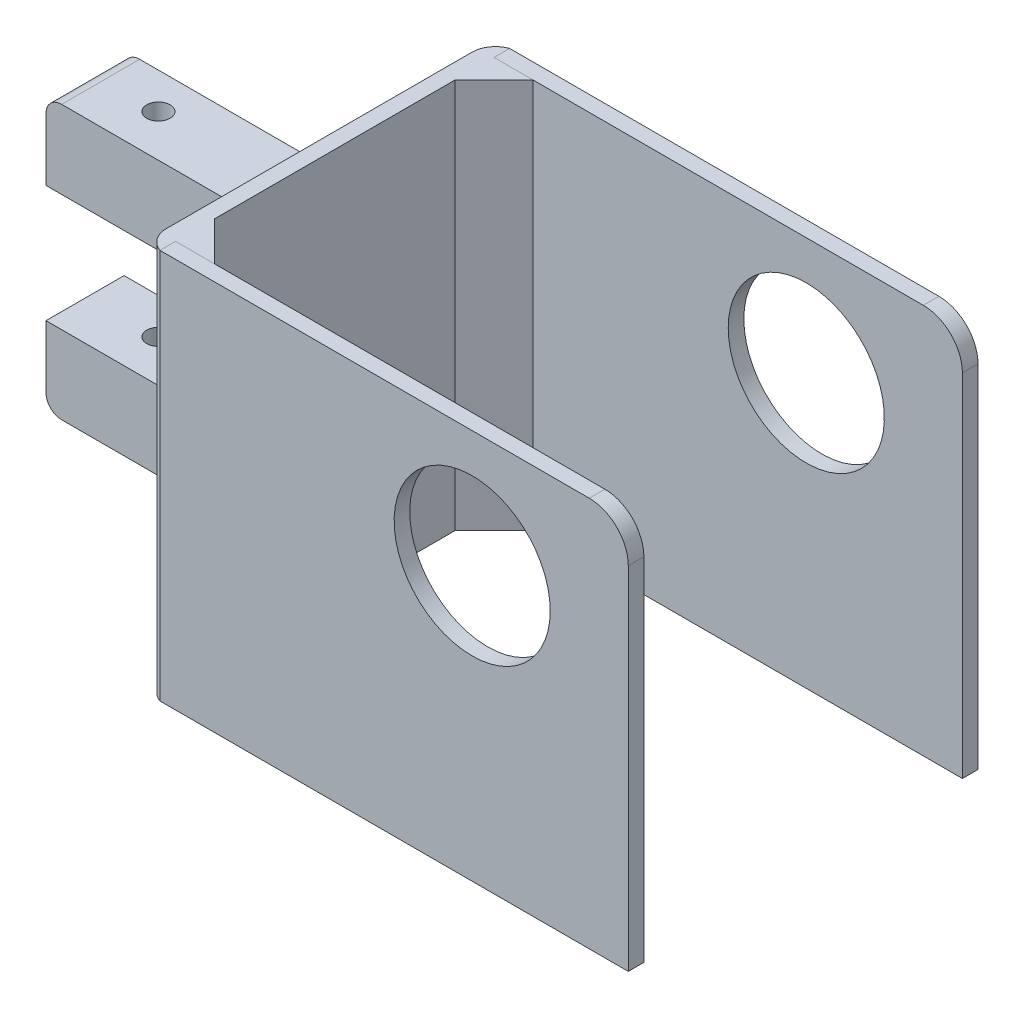
from build123d import *

# Parameters (mm, degrees)
SKETCH_3_R               = 3
EXTRUDE_6_DEPTH          = 0.001
EXTRUDE_6_2_DEPTH        = 0.001
EXTRUDE_6_3_DEPTH        = 0.001
EXTRUDE_6_4_DEPTH        = 0.001
CUT_EXTRUDE_2_DEPTH      = 67.213034483
CUT_EXTRUDE_2_DEPTH_BACK = 67.213034483
SKETCH_11_R              = 2.25
EXTRUDE_7_DEPTH          = 2
EXTRUDE_7_DEPTH_BACK     = 0.801922547
SKETCH_14_R              = 10
CUT_EXTRUDE_3_DEPTH      = 3
SKETCH_12_4_R            = 10
EXTRUDE_10_DEPTH         = 44
SKETCH_20_W              = 40.801922547
SKETCH_20_H              = 50
CUT_EXTRUDE_6_DEPTH      = 60
SKETCH_21_W              = 44.801922547
SKETCH_21_H              = 50
EXTRUDE_11_DEPTH         = 2
FILLET_2_R               = 5
FILLET_3_R               = 5
FILLET_5_R               = 3
FILLET_6_R               = 3
EXTRUDE_15_DEPTH         = 50
SKETCH_36_W              = 10
SKETCH_36_H              = 35
EXTRUDE_16_DEPTH         = 30
FILLET_7_R               = 2
CUT_EXTRUDE_8_DEPTH      = 90.636750061
CUT_EXTRUDE_8_DEPTH_BACK = 90.636750061
SKETCH_39_R              = 1.5
SKETCH_38_W              = 10
SKETCH_38_H              = 15
CUT_EXTRUDE_9_DEPTH      = 15


with BuildPart() as part:
    # 草图3 → 凸台-拉伸6 (new body)
    with BuildSketch(Plane.XY):
        with Locations((60.266478541, 16.532501821)):
            Circle(SKETCH_3_R)
    extrude(amount=EXTRUDE_6_DEPTH)


with BuildPart() as body_2:
    # 草图3 → Extrude 6 2 (new body)
    with BuildSketch(Plane.XY):
        with Locations((60.266478541, 6.532501821)):
            Circle(SKETCH_3_R)
    extrude(amount=EXTRUDE_6_2_DEPTH)


with BuildPart() as body_3:
    # 草图3 → Extrude 6 3 (new body)
    with BuildSketch(Plane.XY):
        with Locations((10.766478541, 6.532501821)):
            Circle(SKETCH_3_R)
    extrude(amount=EXTRUDE_6_3_DEPTH)


with BuildPart() as body_4:
    # 草图3 → Extrude 6 4 (new body)
    with BuildSketch(Plane.XY):
        with Locations((10.766478541, 16.532501821)):
            Circle(SKETCH_3_R)
    extrude(amount=EXTRUDE_6_4_DEPTH)


with BuildPart() as cut_extrude_2_tool:
    # 草图11 → 切除-拉伸2 (new, two sides: drawn at the far end of the back side and taken through both)
    with BuildSketch(Plane.XY.offset(0.001).offset(-CUT_EXTRUDE_2_DEPTH_BACK)):
        with Locations((10.766478541, 16.532501821)):
            Circle(SKETCH_11_R)
        with Locations((10.766478541, 6.532501821)):
            Circle(SKETCH_11_R)
        with Locations((60.266478541, 16.532501821)):
            Circle(SKETCH_11_R)
        with Locations((60.266478541, 6.532501821)):
            Circle(SKETCH_11_R)
    extrude(amount=CUT_EXTRUDE_2_DEPTH + CUT_EXTRUDE_2_DEPTH_BACK)


with BuildPart() as part_1:
    add(part.part)

    # 切除-拉伸2: cut by cut_extrude_2_tool
    add(cut_extrude_2_tool.part, mode=Mode.SUBTRACT)



with BuildPart() as body_2_1:
    add(body_2.part)

    # 切除-拉伸2: cut by cut_extrude_2_tool
    add(cut_extrude_2_tool.part, mode=Mode.SUBTRACT)


with BuildPart() as body_3_1:
    add(body_3.part)

    # 切除-拉伸2: cut by cut_extrude_2_tool
    add(cut_extrude_2_tool.part, mode=Mode.SUBTRACT)


with BuildPart() as body_4_1:
    add(body_4.part)

    # 切除-拉伸2: cut by cut_extrude_2_tool
    add(cut_extrude_2_tool.part, mode=Mode.SUBTRACT)


with BuildPart() as body_5:
    # 草图12 → 凸台-拉伸7 (new, two sides: drawn at the far end of the back side and taken through both)
    with BuildSketch(Plane.XY.offset(0.001).offset(-EXTRUDE_7_DEPTH_BACK)):
        Polygon((5.516478541, 26.532501821), (65.516478541, 26.532501821), (65.516478541, -23.467498179), (5.516478541, -23.467498179), (5.516478541, 1.532501821), align=None)
    extrude(amount=EXTRUDE_7_DEPTH + EXTRUDE_7_DEPTH_BACK)

    # 草图14 → 切除-拉伸3 (cut)
    with BuildSketch(Plane(origin=(0, 0, -0.800922547), x_dir=(-1, 0, 0), z_dir=(0, 0, -1))):
        with Locations((-45.516478541, 11.532501821)):
            Circle(SKETCH_14_R)
    extrude(amount=-CUT_EXTRUDE_3_DEPTH, mode=Mode.SUBTRACT)


with BuildPart() as part_2:
    add(part_1.part)

    add(body_2_1.part)  # 凸台-拉伸10 merges body 2

    add(body_3_1.part)  # 凸台-拉伸10 merges body 3

    add(body_4_1.part)  # 凸台-拉伸10 merges body 4

    add(body_5.part)  # 凸台-拉伸10 merges body 5
    # 草图12<4> → 凸台-拉伸10 (add)
    with BuildSketch(Plane.XY.offset(0.001)):
        Polygon((5.516478541, 26.532501821), (65.516478541, 26.532501821), (65.516478541, -23.467498179), (5.516478541, -23.467498179), (5.516478541, 1.532501821), align=None)
        with Locations(Location((45.516478541, 11.532501821, 0), (0, 0, 180))):
            Circle(SKETCH_12_4_R, mode=Mode.SUBTRACT)
    extrude(amount=EXTRUDE_10_DEPTH)

    # 草图20 → 切除-拉伸6 (cut)
    with BuildSketch(Plane(origin=(65.516478541, 0, 0), x_dir=(0, 0, -1), z_dir=(1, 0, 0))):
        with Locations((-21.600038727, 1.532501821)):
            Rectangle(SKETCH_20_W, SKETCH_20_H)
    extrude(amount=-CUT_EXTRUDE_6_DEPTH, mode=Mode.SUBTRACT)


with BuildPart() as cut_extrude_6_piece_1:
    # of the separate pieces the step leaves, piece 1, a body of its own (cut_extrude_6_pieces)
    add(part_2.part.solids().sort_by_distance((5.516478541, 26.532501821, 42.001))[0])

    # 圆角3
    fillet_3_edges = [cut_extrude_6_piece_1.edges().sort_by_distance(p)[0] for p in [
        (65.516478541, 26.532501821, 43.001),
    ]]
    fillet(fillet_3_edges, radius=FILLET_3_R)


with BuildPart() as cut_extrude_6_piece_2:
    # of the separate pieces the step leaves, piece 2, a body of its own (cut_extrude_6_pieces)
    add(part_2.part.solids().sort_by_distance((5.516478541, 26.532501821, -0.800922547))[0])

    # 圆角2
    fillet_2_edges = [cut_extrude_6_piece_2.edges().sort_by_distance(p)[0] for p in [
        (65.516478541, 26.532501821, 0.199077453),
    ]]
    fillet(fillet_2_edges, radius=FILLET_2_R)


with BuildPart() as body_3_2:
    # 草图21 → 凸台-拉伸11 (new body)
    with BuildSketch(Plane.ZY.offset(-5.516478541)):
        with Locations((21.600038727, 1.532501821)):
            Rectangle(SKETCH_21_W, SKETCH_21_H)
    extrude(amount=EXTRUDE_11_DEPTH)

    # 圆角5
    # the kernel refuses this fillet: 3 mm, written as the material it takes off along each edge
    with BuildSketch(Plane(origin=(3.516478541, -30.538565991, 44.001), x_dir=(1, 0, 0), z_dir=(0, 1, 0))) as fillet_5_piece_1:
        with BuildLine():
            CenterArc((3, 2.828427125), FILLET_5_R, 180, 70.528779366)
            Line((0, 2.828427125), (-0.06, 2.828427125))
            Line((-0.06, 2.828427125), (-0.06, 0))
            Line((-0.06, 0), (0, -0.06))
            ThreePointArc((0, -0.06), (1, -0.06), (1.98, -0.056568542))
            Line((1.98, -0.056568542), (2, 0))
        make_face()
    extrude(amount=64.142135624, mode=Mode.SUBTRACT)

    # 圆角6
    # the kernel refuses this fillet: 3 mm, written as the material it takes off along each edge
    with BuildSketch(Plane(origin=(3.516478541, 33.603569633, -0.800922547), x_dir=(0, 0, 1), z_dir=(0, -1, 0))) as fillet_6_piece_1:
        with BuildLine():
            CenterArc((2.828427125, -3), FILLET_6_R, 90, 70.528779366)
            Line((0, -2), (-0.056568542, -1.98))
            ThreePointArc((-0.056568542, -1.98), (-0.06, -1), (-0.06, 0))
            Line((-0.06, 0), (0, 0.06))
            Line((0, 0.06), (2.828427125, 0.06))
            Line((2.828427125, 0.06), (2.828427125, 0))
        make_face()
    extrude(amount=64.142135624, mode=Mode.SUBTRACT)

    # 草图35 → 凸台-拉伸15 (add)
    with BuildSketch(Plane.XZ.offset(23.467498179)):
        Polygon((5.516478541, 42.001), (10.516478541, 42.001), (5.516478541, 37.001), align=None)
        Polygon((5.516478541, 1.199077453), (5.516478541, 6.199077453), (10.516478541, 1.199077453), align=None)
    extrude(amount=-EXTRUDE_15_DEPTH)

    # 草图36 → 凸台-拉伸16 (add)
    with BuildSketch(Plane.ZY.offset(-3.516478541)):
        with Locations((21.600038726, 1.532501821)):
            Rectangle(SKETCH_36_W, SKETCH_36_H)
    extrude(amount=EXTRUDE_16_DEPTH)

    # 圆角7
    fillet_7_edges = [body_3_2.edges().sort_by_distance(p)[0] for p in [
        (-26.483521459, 19.032501821, 21.600038726),
        (-26.483521459, -15.967498179, 21.600038726),
    ]]
    fillet(fillet_7_edges, radius=FILLET_7_R)

    # 草图39 → 切除-拉伸8 (cut, two sides: drawn at the far end of the back side and taken through both)
    with BuildSketch(Plane(origin=(0, 19.032501821, 0), x_dir=(1, 0, 0), z_dir=(0, 1, 0)).offset(-CUT_EXTRUDE_8_DEPTH_BACK)):
        with Locations(Location((-17.483521459, -21.198379325, 0), (0, 0, 180))):
            Circle(SKETCH_39_R)
    extrude(amount=CUT_EXTRUDE_8_DEPTH + CUT_EXTRUDE_8_DEPTH_BACK, mode=Mode.SUBTRACT)

    # 草图38 → 切除-拉伸9 (cut)
    with BuildSketch(Plane.ZY.offset(26.483521459)):
        with Locations((21.600038726, 1.532501821)):
            Rectangle(SKETCH_38_W, SKETCH_38_H)
    extrude(amount=-CUT_EXTRUDE_9_DEPTH, mode=Mode.SUBTRACT)


solid = Compound([cut_extrude_6_piece_1.part, cut_extrude_6_piece_2.part, body_3_2.part])
